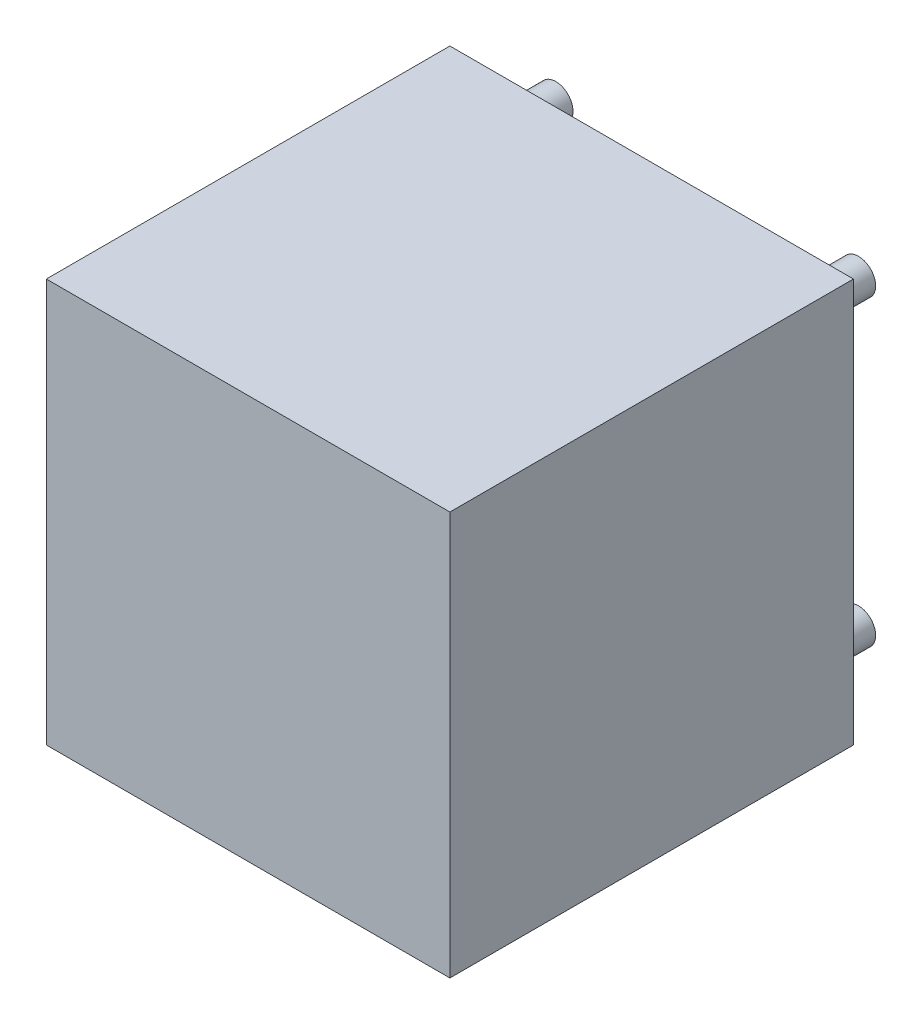
from build123d import *

# Parameters (mm, degrees)
SKETCH1_W               = 40
SKETCH1_H               = 40
BOSS_EXTRUDE1_DEPTH     = 40
SKETCH2_R               = 1.7
BOSS_EXTRUDE2_DEPTH     = 5.5
MIRROR2_COPY_1_SKETCH_R = 1.7
MIRROR2_COPY_1_DEPTH    = 5.5
MIRROR2_COPY_2_SKETCH_R = 1.7
MIRROR2_COPY_2_DEPTH    = 5.5
SKETCH3_R               = 2.5
BOSS_EXTRUDE3_DEPTH     = 10


with BuildPart() as part:
    # Sketch1 → Boss-Extrude1 (new body)
    with BuildSketch(Plane.XY):
        Rectangle(SKETCH1_W, SKETCH1_H)
    extrude(amount=BOSS_EXTRUDE1_DEPTH)

    # Sketch2 → Boss-Extrude2 (add)
    with BuildSketch(Plane(origin=(0, 0, 0), x_dir=(-1, 0, 0), z_dir=(0, 0, -1))):
        with Locations((15, -15)):
            Circle(SKETCH2_R)
    boss_extrude2 = extrude(amount=BOSS_EXTRUDE2_DEPTH)

    # Mirror1: Boss-Extrude2 across plane
    add(boss_extrude2.mirror(Plane(origin=(0, 0, 0), x_dir=(0, 0, 1), z_dir=(1, 0, 0))))

    # Mirror2 copy 1 sketch → Mirror2 copy 1 (add)
    with BuildSketch(Plane(origin=(0, 0, 0), x_dir=(1, 0, 0), z_dir=(0, 0, -1))):
        with Locations((15, -15)):
            Circle(MIRROR2_COPY_1_SKETCH_R)
    extrude(amount=MIRROR2_COPY_1_DEPTH)

    # Mirror2 copy 2 sketch → Mirror2 copy 2 (add)
    with BuildSketch(Plane(origin=(0, 0, 0), x_dir=(-1, 0, 0), z_dir=(0, 0, -1))):
        with Locations((15, 15)):
            Circle(MIRROR2_COPY_2_SKETCH_R)
    extrude(amount=MIRROR2_COPY_2_DEPTH)

    # Sketch3 → Boss-Extrude3 (add)
    with BuildSketch(Plane(origin=(0, 0, 0), x_dir=(-1, 0, 0), z_dir=(0, 0, -1))):
        Circle(SKETCH3_R)
    extrude(amount=BOSS_EXTRUDE3_DEPTH)


solid = part.part
